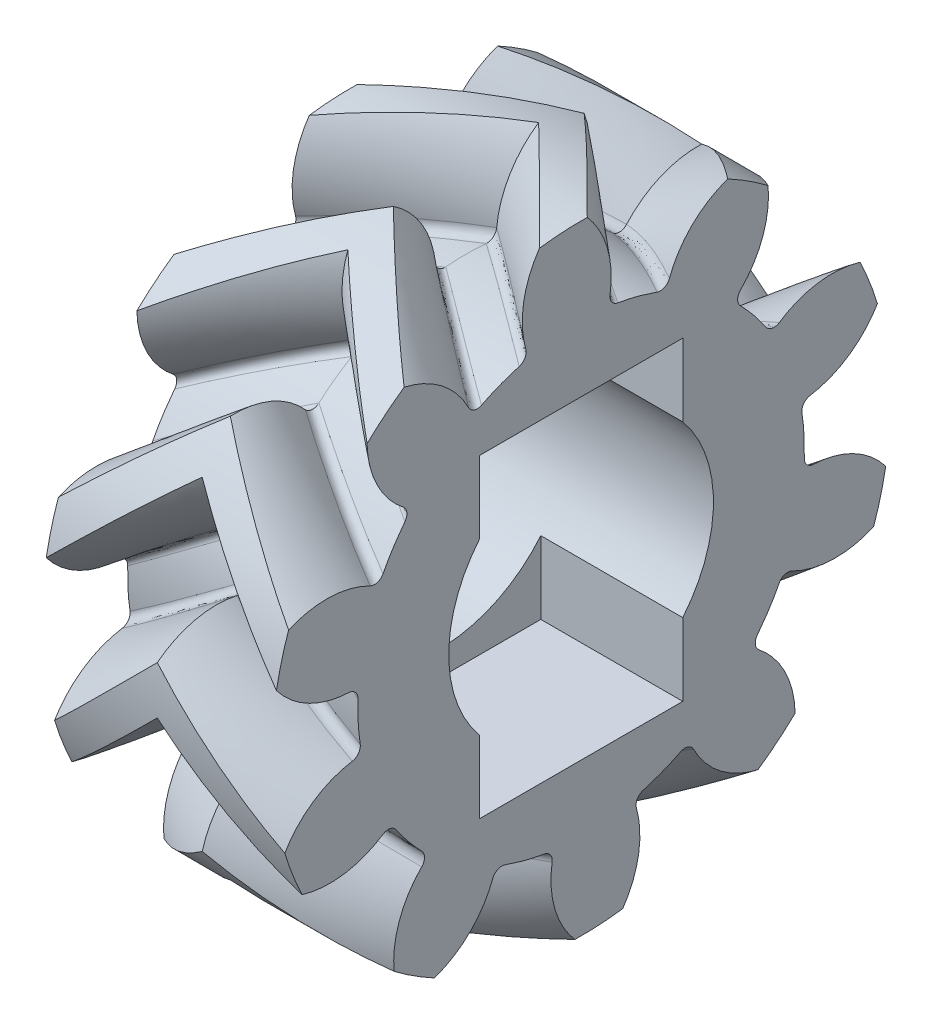
from build123d import *

# Parameters (mm, degrees)
BASPROSKE_W         = 3
BASPROSKE_H         = 8.071067812
TOOTHCUTRH_PITCH    = 50.712014689
TEETHCUTSRH_COUNT   = 10
TEETHCUTSRH_ANGLE   = 324
BORSKE_R            = 2
BORE_DEPTH          = 62.5000025
SKETCH_1_R          = 3.45
CUT_EXTRUDE_1_DEPTH = 13.895126046
SKETCH_2_W          = 5.3
SKETCH_2_H          = 8.2
CUT_EXTRUDE_2_DEPTH = 3.7


with BuildPart() as part:
    # BasProSke → Base-Revolve (revolve)
    with BuildSketch(Plane(origin=(0, 0, 0), x_dir=(1, 0, 0), z_dir=(0, 1, 0)), mode=Mode.PRIVATE) as base_revolve_sk:
        with Locations((1.5, 4.035533906)):
            Rectangle(BASPROSKE_W, BASPROSKE_H)
    revolve(base_revolve_sk.sketch.rotate(Axis((-10, 0, 0), (1, 0, 0)), 180), axis=Axis((-10, 0, 0), (1, 0, 0)))

    # ToothCutRH: the profile of TooCutSkeRH screwed along a right-hand helix of 0.059158 turns, 28 arcs to a turn; built about Z, then put on its axis
    toothcutrh_z = Axis((0, 0, 0), (0, 0, 1))
    toothcutrh_corners = [(5.797155533, -0.527084616, 0), (5.797155533, 0.527084616, 0), (6.021875117, 0.799538895, 0), (8.01860501, 2.193459681, 0), (8.01860501, -2.193459681, 0), (6.021875117, -0.799538895, 0)]
    with BuildLine(mode=Mode.PRIVATE) as toothcutrh_profile:
        ThreePointArc((5.797155533, -0.527084616, 0), (5.821067812, 0, 0), (5.797155533, 0.527084616, 0))
        ThreePointArc((5.797155533, 0.527084616, 0), (5.853490506, 0.709520881, 0), (6.021875117, 0.799538895, 0))
        ThreePointArc((6.021875117, 0.799538895, 0), (7.201430927, 1.236951388, 0), (8.01860501, 2.193459681, 0))
        ThreePointArc((8.01860501, 2.193459681, 0), (8.313199846, 0, 0), (8.01860501, -2.193459681, 0))
        ThreePointArc((8.01860501, -2.193459681, 0), (7.201430927, -1.236951388, 0), (6.021875117, -0.799538895, 0))
        ThreePointArc((6.021875117, -0.799538895, 0), (5.853490506, -0.709520881, 0), (5.797155533, -0.527084616, 0))
    toothcutrh_cap = Face(toothcutrh_profile.wire())
    toothcutrh_arcs = [((5.797155533, -0.527084616, 0), (5.845078724, 0, 0), (5.797155533, 0.527084616, 0), (1, 0.9958921147661806, 1)), ((5.797155533, 0.527084616, 0), (5.774656296, 0.774543133, 0), (6.021875117, 0.799538895, 0), (1, 0.7106663388171159, 1)), ((6.021875117, 0.799538895, 0), (7.408888996, 0.939776877, 0), (8.01860501, 2.193459681, 0), (1, 0.8733854721399384, 1)), ((8.01860501, 2.193459681, 0), (8.618617776, 0, 0), (8.01860501, -2.193459681, 0), (1, 0.9645630032380048, 1)), ((8.01860501, -2.193459681, 0), (7.408888996, -0.939776877, 0), (6.021875117, -0.799538895, 0), (1, 0.8733854721399379, 1)), ((6.021875117, -0.799538895, 0), (5.774656296, -0.774543133, 0), (5.797155533, -0.527084616, 0), (1, 0.7106663388171094, 1))]  # start, shoulder, end, weights
    toothcutrh_turn_angles = [0, 6.428571429, 12.857142857, 17.076935595, 21.296728332]
    toothcutrh_turn_weights = [1, 0.9937122098932426, 1, 0.9972891176971639, 1]
    toothcutrh_turn_sides = [Face.make_bezier_surface([[Vector(p[j][0], p[j][1], 0).rotate(toothcutrh_z, toothcutrh_turn_angles[2 * i + k]) / toothcutrh_turn_weights[2 * i + k] + Vector(0, 0, p[j][2] + TOOTHCUTRH_PITCH * toothcutrh_turn_angles[2 * i + k] / 360) for k in range(3)] for j in range(3)], [[p[3][j] * toothcutrh_turn_weights[2 * i + k] for k in range(3)] for j in range(3)]) for p in toothcutrh_arcs for i in range(2)]
    toothcutrh = Plane(origin=(0, 0, 0), x_dir=(0, 1, 0), z_dir=(1, 0, 0)) * Solid(Shell([*toothcutrh_turn_sides, toothcutrh_cap, toothcutrh_cap.rotate(toothcutrh_z, 21.296728332).moved(Location((0, 0, TOOTHCUTRH_PITCH * 21.296728332 / 360)))]))
    add(toothcutrh, mode=Mode.SUBTRACT)

    # TeethCutsRH: ToothCutRH ×10 about axis
    teethcutsrh_axis = Axis((-10, 0, 0), (1, 0, 0))
    for i in range(1, TEETHCUTSRH_COUNT):
        add(toothcutrh.rotate(teethcutsrh_axis, i * TEETHCUTSRH_ANGLE / (TEETHCUTSRH_COUNT - 1)), mode=Mode.SUBTRACT)

    # BorSke → Bore (cut, symmetric)
    with BuildSketch(Plane(origin=(0, 0, 0), x_dir=(0, 0, -1), z_dir=(1, 0, 0))):
        with Locations(Location((0, 0, 0), (0, 0, 180))):
            Circle(BORSKE_R)
    extrude(amount=BORE_DEPTH, both=True, mode=Mode.SUBTRACT)

    # 鏡射1: part across plane


with BuildPart() as part_1:
    add(part.part)
    add(part.part.mirror(Plane(origin=(0, 0, 0), x_dir=(0, 0, 1), z_dir=(1, 0, 0))))

    # 草圖1 → 除料-伸長1 (cut, through all)
    with BuildSketch(Plane.ZY.offset(-3)):
        Circle(SKETCH_1_R)
    extrude(amount=CUT_EXTRUDE_1_DEPTH, mode=Mode.SUBTRACT)

    # 草圖2 → 除料-伸長2 (cut)
    with BuildSketch(Plane(origin=(3, 0, 0), x_dir=(0, 0, -1), z_dir=(1, 0, 0))):
        Rectangle(SKETCH_2_W, SKETCH_2_H)
    extrude(amount=-CUT_EXTRUDE_2_DEPTH, mode=Mode.SUBTRACT)


solid = part_1.part
